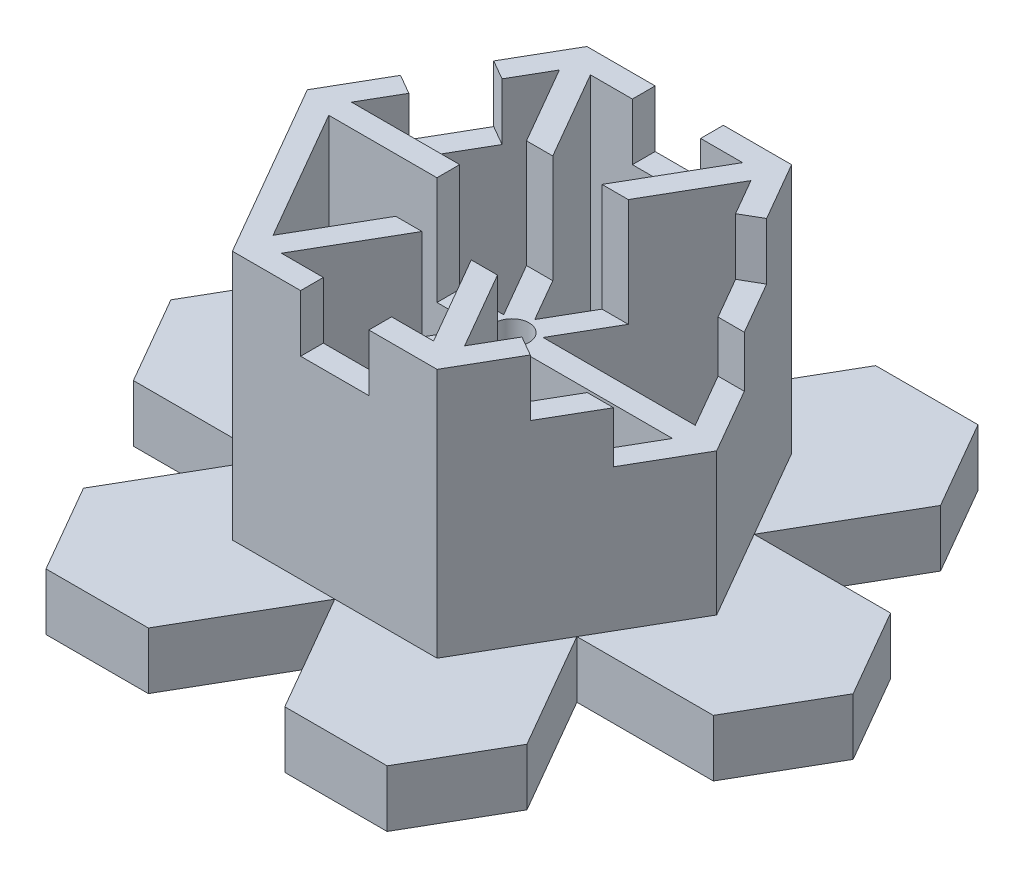
from build123d import *

# Parameters (mm, degrees)
SALIENTE_EXTRUIR1_DEPTH = 10
SALIENTE_EXTRUIR2_DEPTH = 170
CORTAR_EXTRUIR1_DEPTH   = 4
MATRIZC1_COUNT          = 5
MATRIZC1_ANGLE          = 240
CROQUIS4_W              = 24
CROQUIS4_H              = 12
SALIENTE_EXTRUIR3_DEPTH = 36
CROQUIS5_W              = 24
CROQUIS5_H              = 9
CORTAR_EXTRUIR2_DEPTH   = 24
CHAFL_N1_SIZE2          = 36
CHAFL_N1_SIZE           = 98.9091871
CORTAR_EXTRUIR3_DEPTH   = 24
CROQUIS7_W              = 30
CROQUIS7_H              = 18
CROQUIS7_R              = 3
SALIENTE_EXTRUIR4_DEPTH = 3
CROQUIS8_W              = 150
CROQUIS8_H              = 150
CORTAR_EXTRUIR4_DEPTH   = 130
CROQUIS9_W              = 64.5
CROQUIS9_H              = 23
CORTAR_EXTRUIR5_DEPTH   = 19
CROQUIS10_R             = 3
CORTAR_EXTRUIR6_DEPTH   = 8


with BuildPart() as part:
    # Croquis1 → Saliente-Extruir1 (new body)
    with BuildSketch(Plane(origin=(0, 0, 0), x_dir=(1, 0, 0), z_dir=(0, 1, 0))):
        Polygon((-12, 51.961524227), (-30, 51.961524227), (-39, 36.373066959), (-27, 15.588457268), (-51, 15.588457268), (-60, 0), (-51, -15.588457268), (-27, -15.588457268), (-39, -36.373066959), (-30, -51.961524227), (-12, -51.961524227), (0, -31.176914536), (12, -51.961524227), (30, -51.961524227), (39, -36.373066959), (27, -15.588457268), (51, -15.588457268), (60, 0), (51, 15.588457268), (27, 15.588457268), (39, 36.373066959), (30, 51.961524227), (12, 51.961524227), (0, 31.176914536), align=None)
    extrude(amount=SALIENTE_EXTRUIR1_DEPTH)

    # Croquis2 → Saliente-Extruir2 (add)
    # profile 1 of 2: a face of its own
    with BuildSketch(Plane(origin=(0, 10, 0), x_dir=(1, 0, 0), z_dir=(0, 1, 0))):
        Polygon((36, 0), (18, 31.176914536), (-18, 31.176914536), (-36, 0), (-18, -31.176914536), (18, -31.176914536), align=None)
        Polygon((15.690598923, 27.176914536), (-15.690598923, 27.176914536), (-31.381197846, 0), (-15.690598923, -27.176914536), (15.690598923, -27.176914536), (31.381197846, 0), align=None, mode=Mode.SUBTRACT)
    # profile 2 of 2: a face of its own
    with BuildSketch(Plane(origin=(0, 10, 0), x_dir=(1, 0, 0), z_dir=(0, 1, 0))):
        Polygon((-13.381197846, 27.176914536), (-15.690598923, 27.176914536), (-16.845299462, 25.176914536), (-3.464101615, 2), (-30.226497308, 2), (-31.381197846, 0), (-30.226497308, -2), (-3.464101615, -2), (-16.845299462, -25.176914536), (-15.690598923, -27.176914536), (-13.381197846, -27.176914536), (0, -4), (13.381197846, -27.176914536), (15.690598923, -27.176914536), (16.845299462, -25.176914536), (3.464101615, -2), (30.226497308, -2), (31.381197846, 0), (30.226497308, 2), (3.464101615, 2), (16.845299462, 25.176914536), (15.690598923, 27.176914536), (13.381197846, 27.176914536), (0, 4), align=None)
    extrude(amount=SALIENTE_EXTRUIR2_DEPTH)

    # Croquis3 → Cortar-Extruir1 (cut)
    with BuildSketch(Plane.XY.offset(31.176914536)):
        Polygon((-14, 172), (-2, 172), (6, 164), (6, 44), (-6, 44), (-6, 159.029437252), (-6.970562748, 160), (-14, 160), align=None)
    cortar_extruir1 = extrude(amount=-CORTAR_EXTRUIR1_DEPTH, mode=Mode.SUBTRACT)

    # MatrizC1: Cortar-Extruir1 ×5 about axis
    matrizc1_axis = Axis((0, 0, 0), (0, 1, 0))
    for i in range(1, MATRIZC1_COUNT):
        add(cortar_extruir1.rotate(matrizc1_axis, i * MATRIZC1_ANGLE / (MATRIZC1_COUNT - 1)), mode=Mode.SUBTRACT)

    # Croquis4 → Saliente-Extruir3 (add)
    with BuildSketch(Plane(origin=(-27, 0, 15.588457268), x_dir=(0.5000000000000002, 0, 0.8660254037844386), z_dir=(-0.8660254037844386, 0, 0.5000000000000002))):
        with Locations((0, 172)):
            Rectangle(CROQUIS4_W, CROQUIS4_H)
    extrude(amount=SALIENTE_EXTRUIR3_DEPTH)

    # Croquis5 → Cortar-Extruir2 (cut)
    with BuildSketch(Plane(origin=(-58.176914536, 0, 33.588457268), x_dir=(0.5000000000000003, 0, 0.8660254037844386), z_dir=(-0.8660254037844385, 0, 0.5000000000000002))):
        with Locations((0, 173.5)):
            Rectangle(CROQUIS5_W, CROQUIS5_H)
    extrude(amount=-CORTAR_EXTRUIR2_DEPTH, mode=Mode.SUBTRACT)

    # Chaflán1
    chafl_n1_edges = [part.edges().sort_by_distance(p)[0] for p in [
        (-27, 166, 15.588457268),
    ]]
    chafl_n1_side = [part.faces().sort_by_distance(p)[0] for p in [
        (-27, 165.28, 15.588457268),
    ]]
    chamfer(chafl_n1_edges, length=CHAFL_N1_SIZE - 0.0001, length2=CHAFL_N1_SIZE2 - 0.0001, reference=chafl_n1_side[0])  # a hair under: the kernel refuses the full size

    # Croquis6 → Cortar-Extruir3 (cut)
    with BuildSketch(Plane(origin=(-6, 0, -10.392304845), x_dir=(-0.8660254037844385, 0, 0.5000000000000003), z_dir=(-0.5000000000000003, 0, -0.8660254037844385))):
        Polygon((58.663492356, 166), (31.176914536, 90.481248101), (31.176914536, 166), align=None)
    extrude(amount=-CORTAR_EXTRUIR3_DEPTH, mode=Mode.SUBTRACT)

    # Croquis7 → Saliente-Extruir4 (add)
    with BuildSketch(Plane(origin=(-58.176914536, 0, 33.588457268), x_dir=(0.5000000000000003, 0, 0.8660254037844386), z_dir=(-0.8660254037844385, 0, 0.5000000000000002))):
        with Locations((-3, 175)):
            Rectangle(CROQUIS7_W, CROQUIS7_H)
        with Locations((-3, 175)):
            Circle(CROQUIS7_R, mode=Mode.SUBTRACT)
    extrude(amount=-SALIENTE_EXTRUIR4_DEPTH)

    # Croquis8 → Cortar-Extruir4 (cut)
    with BuildSketch(Plane(origin=(0, 184, 0), x_dir=(1, 0, 0), z_dir=(0, 1, 0))):
        Rectangle(CROQUIS8_W, CROQUIS8_H)
    extrude(amount=-CORTAR_EXTRUIR4_DEPTH, mode=Mode.SUBTRACT)

    # Croquis9 → Cortar-Extruir5 (cut)
    with BuildSketch(Plane(origin=(0, 54, 0), x_dir=(1, 0, 0), z_dir=(0, 1, 0))):
        with Locations((21.05, 0)):
            Rectangle(CROQUIS9_W, CROQUIS9_H)
    extrude(amount=-CORTAR_EXTRUIR5_DEPTH, mode=Mode.SUBTRACT)

    # Croquis10 → Cortar-Extruir6 (cut)
    with BuildSketch(Plane(origin=(0, 35, 0), x_dir=(1, 0, 0), z_dir=(0, 1, 0))):
        with Locations(Location((0, 0, 0), (0, 0, 270))):
            Circle(CROQUIS10_R)
    extrude(amount=-CORTAR_EXTRUIR6_DEPTH, mode=Mode.SUBTRACT)


solid = part.part
